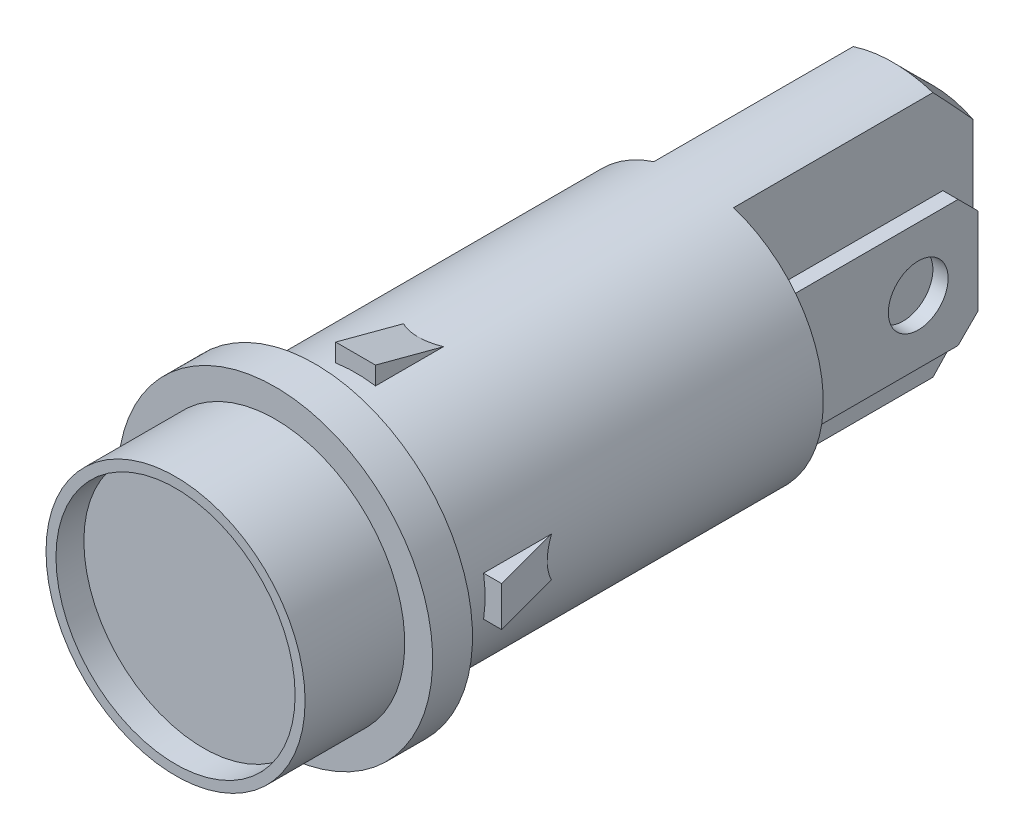
from build123d import *

# Parameters (mm, degrees)
SKETCH1_R                = 6.5
EXTRUDE1_DEPTH           = 36.6
SKETCH2_R                = 7.9
EXTRUDE2_DEPTH           = 2
CUT_EXTRUDE1_DEPTH       = 39.267218347
CUT_EXTRUDE1_DEPTH_BACK  = 39.267218347
SKETCH3_W                = 4.5
SKETCH3_H                = 12
SKETCH4_W                = 0.762
SKETCH4_H                = 6.35
EXTRUDE3_DEPTH           = 10
CHAMFER1_SIZE            = 1
CUT_EXTRUDE2_REACH       = 41.369
SKETCH5_R                = 1.5
CHAMFER1_OF_MIRROR1_SIZE = 1
CHAMFER2_SIZE            = 2
EXTRUDE4_DEPTH           = 1
CIRPATTERN1_COUNT        = 4
SKETCH7_R                = 6.5
SKETCH7_R_2              = 6
EXTRUDE_THIN1_DEPTH      = 5


with BuildPart() as part:
    # Sketch1 → Extrude1 (new body)
    with BuildSketch(Plane.XY):
        Circle(SKETCH1_R)
    extrude(amount=EXTRUDE1_DEPTH)

    # Sketch2 → Extrude2 (add)
    with BuildSketch(Plane(origin=(0, 0, 31), x_dir=(-1, 0, 0), z_dir=(0, 0, -1))):
        Circle(SKETCH2_R)
    extrude(amount=-EXTRUDE2_DEPTH)

    # Sketch3 → Cut-Extrude1 (cut, two sides: drawn at the far end of the back side and taken through both)
    with BuildSketch(Plane(origin=(0, 0, 0), x_dir=(1, 0, 0), z_dir=(0, 1, 0)).offset(-CUT_EXTRUDE1_DEPTH_BACK)):
        with Locations((4.25, -6)):
            Rectangle(SKETCH3_W, SKETCH3_H)
        with Locations((-4.25, -6)):
            Rectangle(SKETCH3_W, SKETCH3_H)
    extrude(amount=CUT_EXTRUDE1_DEPTH + CUT_EXTRUDE1_DEPTH_BACK, mode=Mode.SUBTRACT)

    # Sketch4 → Extrude3 (add)
    with BuildSketch(Plane(origin=(0, 0, 12), x_dir=(-1, 0, 0), z_dir=(0, 0, -1))):
        with Locations((-3.881, 0)):
            Rectangle(SKETCH4_W, SKETCH4_H)
    extrude3 = extrude(amount=EXTRUDE3_DEPTH)

    # Chamfer1
    chamfer1_edges = [part.edges().sort_by_distance(p)[0] for p in [
        (3.881, -3.175, 2),
        (3.881, 3.175, 2),
    ]]
    chamfer(chamfer1_edges, length=CHAMFER1_SIZE)

    # Sketch5 → Cut-Extrude2 (cut, up to next)
    with BuildSketch(Plane(origin=(4.262, 0, 0), x_dir=(0, 0, -1), z_dir=(1, 0, 0)), mode=Mode.PRIVATE) as cut_extrude2_sk1:
        with Locations((-5, 0)):
            Circle(SKETCH5_R)
    cut_extrude2_tool1 = extrude(cut_extrude2_sk1.sketch, amount=-CUT_EXTRUDE2_REACH, mode=Mode.PRIVATE) & part.part
    cut_extrude2 = cut_extrude2_tool1.solids().sort_by_distance((4.262, 0, 5))[0]
    add(cut_extrude2, mode=Mode.SUBTRACT)

    # Mirror1: Extrude3, Cut-Extrude2 across plane
    add(extrude3.mirror(Plane(origin=(0, 0, 0), x_dir=(0, 0, 1), z_dir=(1, 0, 0))))
    add(cut_extrude2.mirror(Plane(origin=(0, 0, 0), x_dir=(0, 0, 1), z_dir=(1, 0, 0))), mode=Mode.SUBTRACT)

    # Chamfer1 of Mirror1
    chamfer1_of_mirror1_edges = [part.edges().sort_by_distance(p)[0] for p in [
        (-3.881, -3.175, 2),
        (-3.881, 3.175, 2),
    ]]
    chamfer(chamfer1_of_mirror1_edges, length=CHAMFER1_OF_MIRROR1_SIZE)

    # Chamfer2
    chamfer2_edges = [part.edges().sort_by_distance(p)[0] for p in [
        (0, -6.5, 0),
        (0, 6.5, 0),
    ]]
    chamfer(chamfer2_edges, length=CHAMFER2_SIZE)

    # Sketch6 → Extrude4 (add, symmetric)
    with BuildSketch(Plane(origin=(0, 0, 0), x_dir=(1, 0, 0), z_dir=(0, 1, 0))):
        Polygon((4.701960739, -19.092839001), (7.329685983, -28.968), (4.701960739, -28.968), align=None)
    extrude4 = extrude(amount=EXTRUDE4_DEPTH, both=True)

    # CirPattern1: Extrude4 ×4 about axis
    cirpattern1_axis = Axis((0, 0, 36.6), (0, 0, -1))
    for i in range(1, CIRPATTERN1_COUNT):
        add(extrude4.rotate(cirpattern1_axis, i * 360 / CIRPATTERN1_COUNT))

    # Sketch7 → Extrude-Thin1 (add)
    with BuildSketch(Plane.XY.offset(33)):
        Circle(SKETCH7_R)
        Circle(SKETCH7_R_2, mode=Mode.SUBTRACT)
    extrude(amount=EXTRUDE_THIN1_DEPTH)


solid = part.part
